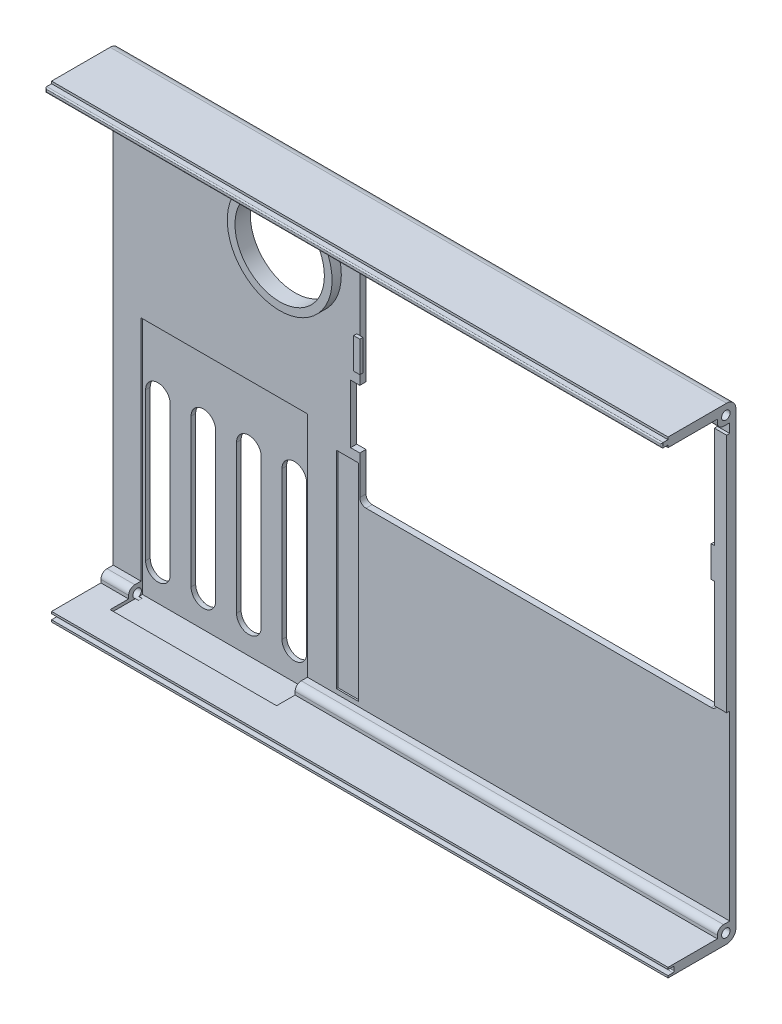
from build123d import *
from build123d.topology import SkipClean

# Parameters (mm, degrees)
SKETCH1_W                = 200
SKETCH1_H                = 152
BODY_DEPTH               = 2
SKETCH3_R                = 14.5
FAN_EXHAUST_GRILL_DEPTH  = 139.567397543
SKETCH12_W               = 200
SKETCH12_H               = 6
SIDE_WALLS_DEPTH         = 20
MOUNT_HOLES_L_DEPTH      = 221.580877825
MOUNT_HOLES_L_DEPTH_BACK = 10
SKETCH14_R               = 1.375
MOUNT_HOLES_R_START      = -10
SKETCH16_R               = 1.375
MOUNT_HOLES_R_DEPTH      = 10
SKETCH18_W               = 16
SKETCH18_H               = 3
WALL_REDUCE_DEPTH        = 221.580877825
SKETCH19_W               = 200
SKETCH19_H               = 1.7
GROOVE_DEPTH             = 2
SKETCH20_W               = 200
SKETCH20_H               = 1.5
NOTCH_DEPTH              = 2
SKETCH21_W               = 116
SKETCH21_H               = 82.5
BATT_CUT_DEPTH           = 141.288715376
FILLET1_R                = 3
FILLET2_R                = 2
FILLET3_R                = 0.4
FILLET4_R                = 2
SKETCH22_R               = 17
SKETCH22_R_2             = 14.5
FAN_HOLE_SUPP_DEPTH      = 3
SKETCH23_W               = 4
SKETCH23_H               = 78
BATT_CUT_SUPP_DEPTH      = 1
CUT_EXTRUDE1_START       = 10
SKETCH24_W               = 54
SKETCH24_H               = 78
SKETCH24_W_2             = 7
SKETCH24_H_2             = 67
CUT_EXTRUDE1_DEPTH       = 10.5
SKETCH25_W               = 3
SKETCH25_H               = 19
CUT_EXTRUDE2_DEPTH       = 141.288715376
SKETCH26_W               = 1
SKETCH26_H               = 10
BOSS_EXTRUDE1_DEPTH      = 1
SKETCH27_W               = 1
SKETCH27_H               = 10
BOSS_EXTRUDE2_DEPTH      = 1
SKETCH28_W               = 1
SKETCH28_H               = 10
BOSS_EXTRUDE3_DEPTH      = 1


with BuildPart() as part:
    # Sketch1 → body (new body)
    with BuildSketch(Plane.XY):
        with Locations((5, -14.39869281)):
            Rectangle(SKETCH1_W, SKETCH1_H)
    extrude(amount=BODY_DEPTH)

    # Sketch3 → fan_exhaust_grill (cut, through all)
    with BuildSketch(Plane(origin=(0, 0, 0), x_dir=(-1, 0, 0), z_dir=(0, 0, -1))):
        with Locations((38, 34.10130719)):
            Circle(SKETCH3_R)
        with BuildLine():
            Line((62.25, -78.39869281), (62.25, -30.39869281))
            ThreePointArc((62.25, -30.39869281), (66.25, -26.39869281), (70.25, -30.39869281))
            Line((70.25, -30.39869281), (70.25, -78.39869281))
            ThreePointArc((70.25, -78.39869281), (66.25, -82.39869281), (62.25, -78.39869281))
        make_face()
        with BuildLine():
            Line((77, -78.39869281), (77, -30.39869281))
            ThreePointArc((77, -30.39869281), (81, -26.39869281), (85, -30.39869281))
            Line((85, -30.39869281), (85, -78.39869281))
            ThreePointArc((85, -78.39869281), (81, -82.39869281), (77, -78.39869281))
        make_face()
        with BuildLine():
            Line((47.5, -78.39869281), (47.5, -30.39869281))
            ThreePointArc((47.5, -30.39869281), (51.5, -26.39869281), (55.5, -30.39869281))
            Line((55.5, -30.39869281), (55.5, -78.39869281))
            ThreePointArc((55.5, -78.39869281), (51.5, -82.39869281), (47.5, -78.39869281))
        make_face()
        with BuildLine():
            Line((32.75, -78.39869281), (32.75, -30.39869281))
            ThreePointArc((32.75, -30.39869281), (36.75, -26.39869281), (40.75, -30.39869281))
            Line((40.75, -30.39869281), (40.75, -78.39869281))
            ThreePointArc((40.75, -78.39869281), (36.75, -82.39869281), (32.75, -78.39869281))
        make_face()
    extrude(amount=-FAN_EXHAUST_GRILL_DEPTH, mode=Mode.SUBTRACT)

    # Sketch12 → side_walls (add)
    with BuildSketch(Plane.XY.offset(2)):
        with Locations((5, -87.39869281)):
            Rectangle(SKETCH12_W, SKETCH12_H)
        with Locations((5, 58.60130719)):
            Rectangle(SKETCH12_W, SKETCH12_H)
    extrude(amount=SIDE_WALLS_DEPTH)

    # Sketch14 → mount_holes_l (cut, two sides: drawn at the far end of the back side and taken through both)
    with BuildSketch(Plane(origin=(105, 0, 0), x_dir=(0, 0, -1), z_dir=(1, 0, 0)).offset(-MOUNT_HOLES_L_DEPTH_BACK)):
        with Locations((-3.25, -87.14869281)):
            Circle(SKETCH14_R)
        with Locations((-3.25, 58.35130719)):
            Circle(SKETCH14_R)
    extrude(amount=MOUNT_HOLES_L_DEPTH + MOUNT_HOLES_L_DEPTH_BACK, mode=Mode.SUBTRACT)

    # Sketch16 → mount_holes_r (cut)
    with BuildSketch(Plane.ZY.offset(95).offset(MOUNT_HOLES_R_START)):
        with Locations((3.25, -87.14869281)):
            Circle(SKETCH16_R)
        with Locations((3.25, 58.35130719)):
            Circle(SKETCH16_R)
    extrude(amount=MOUNT_HOLES_R_DEPTH, mode=Mode.SUBTRACT)

    # Sketch18 → wall_reduce (cut, through all)
    with BuildSketch(Plane(origin=(105, 0, 0), x_dir=(0, 0, -1), z_dir=(1, 0, 0))):
        with Locations((-14, -85.89869281)):
            Rectangle(SKETCH18_W, SKETCH18_H)
        with Locations((-14, 57.10130719)):
            Rectangle(SKETCH18_W, SKETCH18_H)
    extrude(amount=-WALL_REDUCE_DEPTH, mode=Mode.SUBTRACT)

    # Sketch19 → groove (cut)
    with BuildSketch(Plane.XY.offset(22)):
        with Locations((5, -88.89869281)):
            Rectangle(SKETCH19_W, SKETCH19_H)
    extrude(amount=-GROOVE_DEPTH, mode=Mode.SUBTRACT)

    # Sketch20 → notch (add)
    with BuildSketch(Plane.XY.offset(22)):
        with Locations((5, 60.10130719)):
            Rectangle(SKETCH20_W, SKETCH20_H)
    extrude(amount=NOTCH_DEPTH)

    # Sketch21 → batt_cut (cut, through all)
    with BuildSketch(Plane.XY.offset(2)):
        with Locations((43, 13.85130719)):
            Rectangle(SKETCH21_W, SKETCH21_H)
    extrude(amount=-BATT_CUT_DEPTH, mode=Mode.SUBTRACT)

    # Fillet1
    fillet1_edges = [part.edges().sort_by_distance(p)[0] for p in [
        (5, -90.39869281, 0),
        (5, 61.60130719, 0),
    ]]
    fillet(fillet1_edges, radius=FILLET1_R)

    # Fillet2
    fillet2_edges = [part.edges().sort_by_distance(p)[0] for p in [
        (5, -84.39869281, 6),
        (5, 55.60130719, 6),
    ]]
    fillet(fillet2_edges, radius=FILLET2_R)

    # Fillet3
    fillet3_edges = [part.edges().sort_by_distance(p)[0] for p in [
        (5, 60.85130719, 24),
        (105, 60.10130719, 24),
        (5, 59.35130719, 24),
        (-95, 60.10130719, 24),
        (5, -89.74869281, 20),
        (5, -88.04869281, 20),
    ]]
    fillet(fillet3_edges, radius=FILLET3_R)

    # Fillet4
    fillet4_edges = [part.edges().sort_by_distance(p)[0] for p in [
        (-15, -27.39869281, 1),
        (101, -27.39869281, 1),
        (101, 55.10130719, 1),
        (-15, 55.10130719, 1),
    ]]
    fillet(fillet4_edges, radius=FILLET4_R)

    # Sketch22 → fan_hole_supp (add)
    with SkipClean():  # the faces are left unmerged after this step: merging them gives an invalid solid
        with BuildSketch(Plane.XY.offset(2)):
            with Locations((-38, 34.10130719)):
                Circle(SKETCH22_R)
            with Locations((-38, 34.10130719)):
                Circle(SKETCH22_R_2, mode=Mode.SUBTRACT)
        extrude(amount=FAN_HOLE_SUPP_DEPTH)

    # Sketch23 → batt_cut_supp (add)
    with SkipClean():  # the faces are left unmerged after this step: merging them gives an invalid solid
        with BuildSketch(Plane.XY.offset(2)):
            with Locations((103, 13.60130719)):
                Rectangle(SKETCH23_W, SKETCH23_H)
        extrude(amount=BATT_CUT_SUPP_DEPTH)

    # Sketch24 → Cut-Extrude1 (cut)
    with SkipClean():  # the faces are left unmerged after this step: merging them gives an invalid solid
        with BuildSketch(Plane.XY.offset(2).offset(CUT_EXTRUDE1_START)):
            with Locations((-59, -49.39869281)):
                Rectangle(SKETCH24_W, SKETCH24_H)
            with Locations((-19, -49.39869281)):
                Rectangle(SKETCH24_W_2, SKETCH24_H_2)
        extrude(amount=-CUT_EXTRUDE1_DEPTH, mode=Mode.SUBTRACT)

    # Sketch25 → Cut-Extrude2 (cut, through all)
    with SkipClean():  # the faces are left unmerged after this step: merging them gives an invalid solid
        with BuildSketch(Plane.XY.offset(2)):
            with Locations((-16.5, -3.39869281)):
                Rectangle(SKETCH25_W, SKETCH25_H)
        extrude(amount=-CUT_EXTRUDE2_DEPTH, mode=Mode.SUBTRACT)

    # Sketch26 → Boss-Extrude1 (add)
    with SkipClean():  # the faces are left unmerged after this step: merging them gives an invalid solid
        with BuildSketch(Plane.XY.offset(2)):
            with Locations((-15.5, 15.10130719)):
                Rectangle(SKETCH26_W, SKETCH26_H)
        extrude(amount=BOSS_EXTRUDE1_DEPTH)

    # Sketch27 → Boss-Extrude2 (add)
    with SkipClean():  # the faces are left unmerged after this step: merging them gives an invalid solid
        with BuildSketch(Plane(origin=(-15, 0, 0), x_dir=(0, 0, -1), z_dir=(1, 0, 0))):
            with Locations((-2.5, 15.10130719)):
                Rectangle(SKETCH27_W, SKETCH27_H)
        extrude(amount=BOSS_EXTRUDE2_DEPTH)

    # Sketch28 → Boss-Extrude3 (add)
    with SkipClean():  # the faces are left unmerged after this step: merging them gives an invalid solid
        with BuildSketch(Plane.ZY.offset(-101)):
            with Locations((2.5, 14.60130719)):
                Rectangle(SKETCH28_W, SKETCH28_H)
        extrude(amount=BOSS_EXTRUDE3_DEPTH)


solid = part.part
